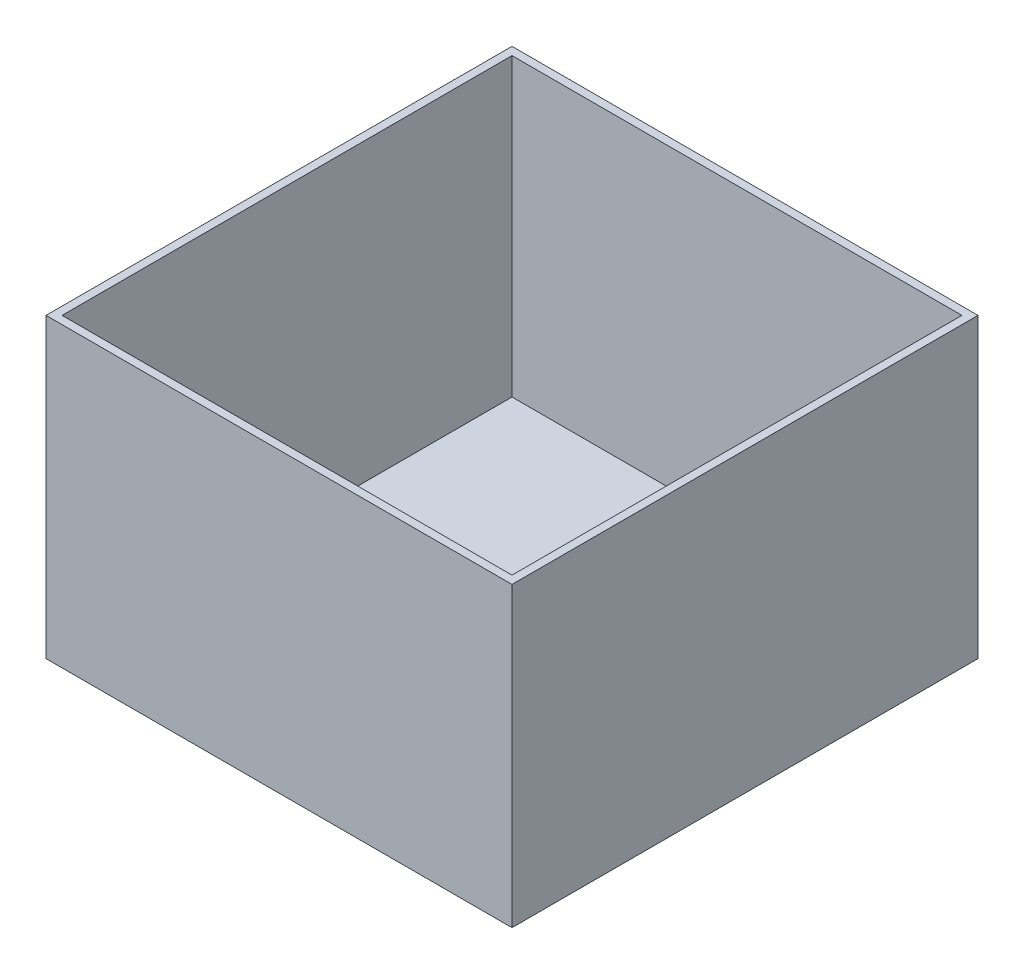
from build123d import *

# Parameters (mm, degrees)
SKETCH1_W           = 184.15
SKETCH1_H           = 184.15
BOSS_EXTRUDE1_DEPTH = 117.475
SKETCH2_W           = 177.8
SKETCH2_H           = 177.8
CUT_EXTRUDE1_DEPTH  = 116.84
SKETCH3_R           = 5.842
BOSS_EXTRUDE2_DEPTH = 6.604


with BuildPart() as part:
    # Sketch1 → Boss-Extrude1 (new body)
    with BuildSketch(Plane(origin=(0, 0, 0), x_dir=(1, 0, 0), z_dir=(0, 1, 0))):
        Rectangle(SKETCH1_W, SKETCH1_H)
    extrude(amount=BOSS_EXTRUDE1_DEPTH)

    # Sketch2 → Cut-Extrude1 (cut)
    with BuildSketch(Plane(origin=(0, 117.475, 0), x_dir=(1, 0, 0), z_dir=(0, 1, 0))):
        Rectangle(SKETCH2_W, SKETCH2_H)
    extrude(amount=-CUT_EXTRUDE1_DEPTH, mode=Mode.SUBTRACT)

    # Sketch3 → Boss-Extrude2 (add)
    with BuildSketch(Plane(origin=(0, 0.635, 0), x_dir=(1, 0, 0), z_dir=(0, 1, 0))):
        with Locations((-1.016, 78.651394374)):
            Circle(SKETCH3_R)
    extrude(amount=BOSS_EXTRUDE2_DEPTH)


solid = part.part
